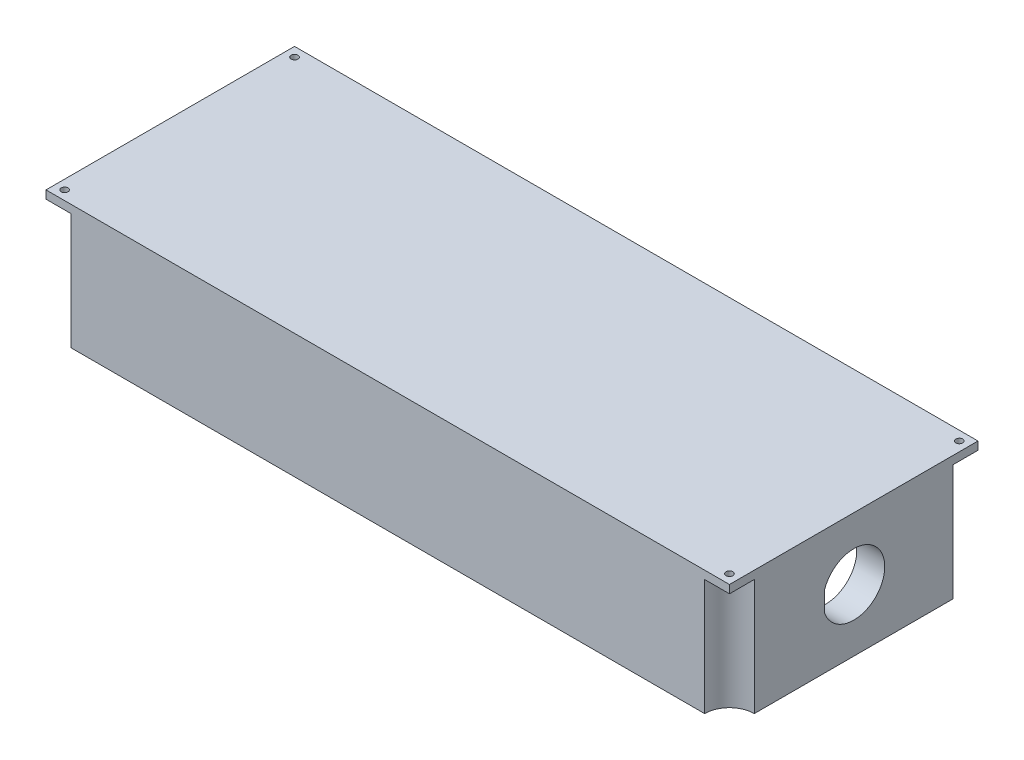
from build123d import *

# Parameters (mm, degrees)
BOSS_EXTRUDE1_DEPTH      = 50.8
SKETCH2_W                = 205.74
SKETCH2_H                = 78.74
CUT_EXTRUDE1_DEPTH       = 101.6
SKETCH14_W               = 205.74
SKETCH14_H               = 17.78
MOUNTINGEDGE_DEPTH       = 10.16
BOTTOM_REACH             = 279.433
SKETCH16_W               = 58.42
SKETCH16_H               = 3.81
SKETCH17_W               = 12.7
SKETCH17_H               = 12.7
SKETCH17_W_2             = 14.986
SKETCH17_H_2             = 14.986
SKETCH17_W_3             = 10
SKETCH17_H_3             = 12
RPITOWERS_DEPTH          = 10.16
SKETCH21_W               = 10.16
SKETCH21_H               = 58.42
BOSS_EXTRUDE11_DEPTH     = 13.97
SKETCH22_W               = 10.16
SKETCH22_H               = 58.42
BOSS_EXTRUDE12_DEPTH     = 13.97
MOUNTHOLE1_START         = -30.48
SKETCH23_R               = 10.16
MOUNTHOLE1_DEPTH         = 207.491003986
SKETCH25_R               = 1.4
CUT_EXTRUDE7_DEPTH       = 180.149965124
SKETCH26_W               = 10
SKETCH26_H               = 2.032
CUT_EXTRUDE8_DEPTH       = 25.24
CUT_EXTRUDE9_DEPTH       = 177.011003986
CUT_EXTRUDE9_DEPTH_BACK  = 30.48
SKETCH28_W               = 50.8
SKETCH28_H               = 78.74
CUT_EXTRUDE10_DEPTH      = 289.488543967
CUT_EXTRUDE10_DEPTH_BACK = 30.48
MIRROR4_START            = -30.48
MIRROR4_COPY_1_SKETCH_R  = 10.16
MIRROR4_COPY_1_DEPTH     = 207.491003986
MIRROR4_COPY_2_SKETCH_R  = 1.4
MIRROR4_COPY_2_DEPTH     = 180.149965124
MIRROR4_COPY_3_SKETCH_R  = 10.16
MIRROR4_COPY_3_DEPTH     = 207.491003986
MIRROR4_COPY_4_SKETCH_R  = 1.4
MIRROR4_COPY_4_DEPTH     = 180.149965124
CUT_EXTRUDE14_START      = -2.54
SKETCH33_R               = 1.4224
CUT_EXTRUDE14_DEPTH      = 20.32
SKETCH35_R               = 5.715
CUT_EXTRUDE16_DEPTH      = 12.7
SKETCH36_R               = 6.731
CUT_EXTRUDE17_DEPTH      = 12.7
SKETCH37_R               = 5.08
CUT_EXTRUDE18_DEPTH      = 12.7
SKETCH38_R               = 1.524
CUT_EXTRUDE19_DEPTH      = 5.08


with BuildPart() as part:
    # Sketch1 → Boss-Extrude1 (new body)
    with BuildSketch(Plane(origin=(0, 0, 0), x_dir=(1, 0, 0), z_dir=(0, 1, 0))):
        Polygon((114.3, 50.8), (165.1, 50.8), (165.1, -50.8), (114.3, -50.8), (-114.3, -50.8), (-114.3, 50.8), align=None)
    extrude(amount=-BOSS_EXTRUDE1_DEPTH)

    # Sketch2 → Cut-Extrude1 (cut)
    with BuildSketch(Plane(origin=(0, 0, 0), x_dir=(1, 0, 0), z_dir=(0, 1, 0))):
        Rectangle(SKETCH2_W, SKETCH2_H)
    extrude(amount=-CUT_EXTRUDE1_DEPTH, mode=Mode.SUBTRACT)

    # Sketch14 → mountingEdge (add)
    with BuildSketch(Plane(origin=(0, 0, 39.37), x_dir=(-1, 0, 0), z_dir=(0, 0, -1))):
        with Locations((0, -8.89)):
            Rectangle(SKETCH14_W, SKETCH14_H)
    mountingedge = extrude(amount=MOUNTINGEDGE_DEPTH)

    # Mirror1: mountingEdge across plane
    add(mountingedge.mirror(Plane.XY))

    # Sketch16 → bottom (add, up to next)
    with BuildSketch(Plane(origin=(-102.87, 0, 0), x_dir=(0, 0, -1), z_dir=(1, 0, 0)), mode=Mode.PRIVATE) as bottom_sk1:
        with Locations((0, -1.905)):
            Rectangle(SKETCH16_W, SKETCH16_H)
    bottom_tool1 = extrude(bottom_sk1.sketch, amount=BOTTOM_REACH, mode=Mode.PRIVATE) - part.part
    add(bottom_tool1.solids().sort_by_distance((-102.87, -1.905, 0))[0])

    # Sketch17 → rpitowers (add)
    with BuildSketch(Plane.XZ.offset(3.81)):
        with Locations((-28.702, 11.43)):
            Rectangle(SKETCH17_W, SKETCH17_H)
        with Locations((-12.065, 12.065)):
            Rectangle(SKETCH17_W_2, SKETCH17_H_2)
        with Locations((21.764, -9.928)):
            Rectangle(SKETCH17_W_3, SKETCH17_H_3)
    extrude(amount=RPITOWERS_DEPTH)

    # Sketch21 → Boss-Extrude11 (add)
    with BuildSketch(Plane.XZ.offset(3.81)):
        with Locations((-97.79, 0)):
            Rectangle(SKETCH21_W, SKETCH21_H)
    extrude(amount=BOSS_EXTRUDE11_DEPTH)

    # Sketch22 → Boss-Extrude12 (add)
    with BuildSketch(Plane.XZ.offset(3.81)):
        with Locations((97.79, 0)):
            Rectangle(SKETCH22_W, SKETCH22_H)
    extrude(amount=BOSS_EXTRUDE12_DEPTH)

    # Sketch23 → MountHole1 (cut)
    with BuildSketch(Plane(origin=(0, -33.782, 0), x_dir=(-1, 0, 0), z_dir=(0, -1, 0)).offset(MOUNTHOLE1_START)):
        with Locations((114.3, 50.8)):
            Circle(SKETCH23_R)
    mounthole1 = extrude(amount=MOUNTHOLE1_DEPTH, mode=Mode.SUBTRACT)

    # Sketch25 → Cut-Extrude7 (cut, through all)
    with BuildSketch(Plane.XZ.offset(3.302)):
        with Locations((-110.49, -46.99)):
            Circle(SKETCH25_R)
    cut_extrude7 = extrude(amount=-CUT_EXTRUDE7_DEPTH, mode=Mode.SUBTRACT)

    # Mirror3: MountHole1, Cut-Extrude7 across plane
    add(mounthole1.mirror(Plane.XY), mode=Mode.SUBTRACT)
    add(cut_extrude7.mirror(Plane.XY), mode=Mode.SUBTRACT)

    # Sketch26 → Cut-Extrude8 (cut)
    with BuildSketch(Plane.XY):
        with Locations((21.764, -12.954)):
            Rectangle(SKETCH26_W, SKETCH26_H)
    extrude(amount=-CUT_EXTRUDE8_DEPTH, mode=Mode.SUBTRACT)

    # Sketch28 → Cut-Extrude9 (cut, two sides: drawn at the far end of the back side and taken through both)
    with BuildSketch(Plane.XZ.offset(33.782).offset(-CUT_EXTRUDE9_DEPTH_BACK)):
        with Locations((128.27, 0)):
            Rectangle(SKETCH28_W, SKETCH28_H)
    extrude(amount=CUT_EXTRUDE9_DEPTH + CUT_EXTRUDE9_DEPTH_BACK, mode=Mode.SUBTRACT)

    # Sketch29 → Cut-Extrude10 (cut, two sides: drawn at the far end of the back side and taken through both)
    with BuildSketch(Plane(origin=(165.1, 0, 0), x_dir=(0, 0, -1), z_dir=(1, 0, 0)).offset(-CUT_EXTRUDE10_DEPTH_BACK)):
        with BuildLine():
            Line((-11.86902628, -21.109021091), (-11.86902628, -29.690978909))
            ThreePointArc((-11.86902628, -29.690978909), (12.68097372, -25.4), (-11.86902628, -21.109021091))
        make_face()
    extrude(amount=CUT_EXTRUDE10_DEPTH + CUT_EXTRUDE10_DEPTH_BACK, mode=Mode.SUBTRACT)

    # Mirror4 copy 1 sketch → Mirror4 copy 1 (cut)
    with BuildSketch(Plane(origin=(50.8, -33.782, 0), x_dir=(1, 0, 0), z_dir=(0, -1, 0)).offset(MIRROR4_START)):
        with Locations((114.3, 50.8)):
            Circle(MIRROR4_COPY_1_SKETCH_R)
    extrude(amount=MIRROR4_COPY_1_DEPTH, mode=Mode.SUBTRACT)

    # Mirror4 copy 2 sketch → Mirror4 copy 2 (cut, through all)
    with BuildSketch(Plane(origin=(50.8, -3.302, 0), x_dir=(-1, 0, 0), z_dir=(0, -1, 0))):
        with Locations((-110.49, -46.99)):
            Circle(MIRROR4_COPY_2_SKETCH_R)
    extrude(amount=-MIRROR4_COPY_2_DEPTH, mode=Mode.SUBTRACT)

    # Mirror4 copy 3 sketch → Mirror4 copy 3 (cut)
    with BuildSketch(Plane(origin=(50.8, -33.782, 0), x_dir=(1, 0, 0), z_dir=(0, -1, 0)).offset(MIRROR4_START)):
        with Locations((114.3, -50.8)):
            Circle(MIRROR4_COPY_3_SKETCH_R)
    extrude(amount=MIRROR4_COPY_3_DEPTH, mode=Mode.SUBTRACT)

    # Mirror4 copy 4 sketch → Mirror4 copy 4 (cut, through all)
    with BuildSketch(Plane(origin=(50.8, -3.302, 0), x_dir=(-1, 0, 0), z_dir=(0, -1, 0))):
        with Locations((-110.49, 46.99)):
            Circle(MIRROR4_COPY_4_SKETCH_R)
    extrude(amount=-MIRROR4_COPY_4_DEPTH, mode=Mode.SUBTRACT)

    # Sketch33 → Cut-Extrude14 (cut)
    with BuildSketch(Plane.XZ.offset(33.782).offset(CUT_EXTRUDE14_START)):
        with Locations((-88.9, -45.72)):
            Circle(SKETCH33_R)
        with Locations((25.4, -45.72)):
            Circle(SKETCH33_R)
        with Locations((139.7, -45.72)):
            Circle(SKETCH33_R)
    cut_extrude14 = extrude(amount=CUT_EXTRUDE14_DEPTH, mode=Mode.SUBTRACT)

    # Mirror5: Cut-Extrude14 across plane
    add(cut_extrude14.mirror(Plane.XY), mode=Mode.SUBTRACT)

    # Sketch35 → Cut-Extrude16 (cut)
    with BuildSketch(Plane(origin=(102.87, 0, 0), x_dir=(0, 0, -1), z_dir=(1, 0, 0))):
        with Locations((1.493484658, -14.732)):
            Circle(SKETCH35_R)
    extrude(amount=-CUT_EXTRUDE16_DEPTH, mode=Mode.SUBTRACT)

    # Sketch36 → Cut-Extrude17 (cut)
    with BuildSketch(Plane.ZY.offset(114.3)):
        with Locations((15.24, -38.1)):
            Circle(SKETCH36_R)
        with Locations((-15.24, -38.1)):
            Circle(SKETCH36_R)
    extrude(amount=-CUT_EXTRUDE17_DEPTH, mode=Mode.SUBTRACT)

    # Sketch37 → Cut-Extrude18 (cut)
    with BuildSketch(Plane(origin=(0, 0, -50.8), x_dir=(-1, 0, 0), z_dir=(0, 0, -1))):
        with Locations((-135.89, -25.4)):
            Circle(SKETCH37_R)
    extrude(amount=-CUT_EXTRUDE18_DEPTH, mode=Mode.SUBTRACT)

    # Sketch38 → Cut-Extrude19 (cut)
    with BuildSketch(Plane.XZ.offset(50.8)):
        with Locations((-109.22, 0)):
            Circle(SKETCH38_R)
    cut_extrude19 = extrude(amount=-CUT_EXTRUDE19_DEPTH, mode=Mode.SUBTRACT)

    # Mirror6: Cut-Extrude19 across plane
    add(cut_extrude19.mirror(Plane(origin=(25.4, 0, 0), x_dir=(0, 0, 1), z_dir=(1, 0, 0))), mode=Mode.SUBTRACT)


solid = part.part
